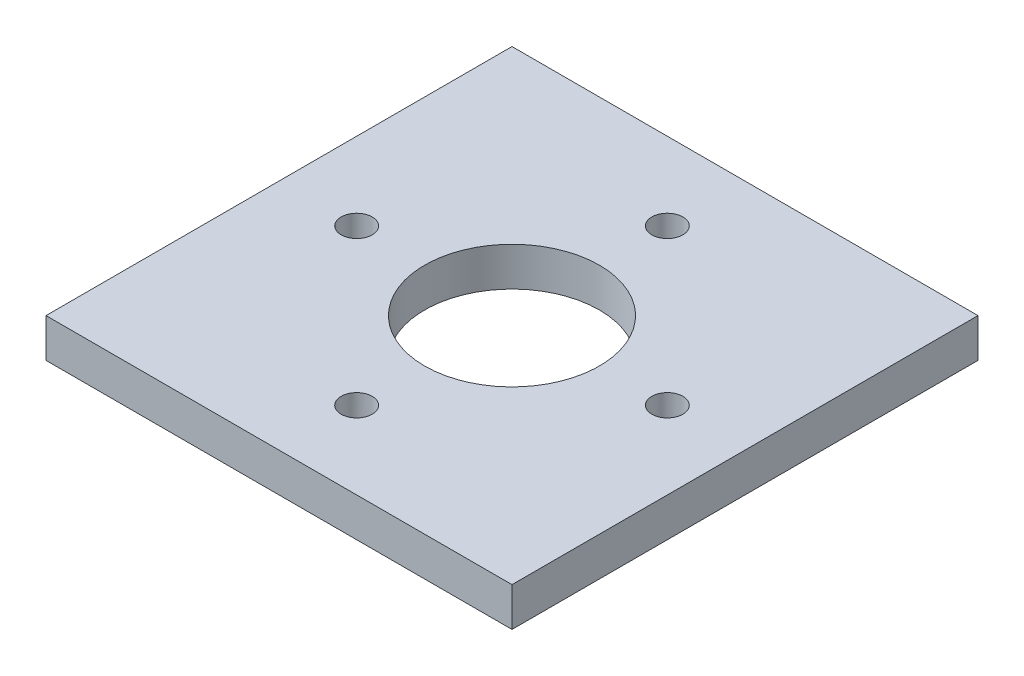
from build123d import *

# Parameters (mm, degrees)
SKETCH1_W                  = 76.2
SKETCH1_H                  = 76.2
SKETCH1_R                  = 14.2875
SKETCH1_R_2                = 2.54
INITIAL_PLATE_DEPTH        = 6.35
MOUNTING_PATTERN_OUTLINE_R = 2.54
MOUNTING_PATTERN_DEPTH     = 6.35


# Read off the part's stored shape, not the designer's step: Mounting Pattern
with BuildPart() as part:
    # Sketch1 → Initial Plate (new body)
    with BuildSketch(Plane(origin=(0, 0, 0), x_dir=(1, 0, 0), z_dir=(0, 1, 0))):
        Rectangle(SKETCH1_W, SKETCH1_H)
        with Locations(Location((0, 0, 0), (0, 0, 270))):
            Circle(SKETCH1_R, mode=Mode.SUBTRACT)
        with Locations(Location((-25.4, 0, 0), (0, 0, 270))):
            Circle(SKETCH1_R_2, mode=Mode.SUBTRACT)
    extrude(amount=INITIAL_PLATE_DEPTH)

    # Mounting Pattern outline → Mounting Pattern (cut)
    with BuildSketch(Plane(origin=(0, 0, 0), x_dir=(1, 0, 0), z_dir=(0, 1, 0))):
        with Locations((0, 25.4)):
            Circle(MOUNTING_PATTERN_OUTLINE_R)
        with Locations((25.4, 0)):
            Circle(MOUNTING_PATTERN_OUTLINE_R)
        with Locations((0, -25.4)):
            Circle(MOUNTING_PATTERN_OUTLINE_R)
    extrude(amount=MOUNTING_PATTERN_DEPTH, mode=Mode.SUBTRACT)


solid = part.part
